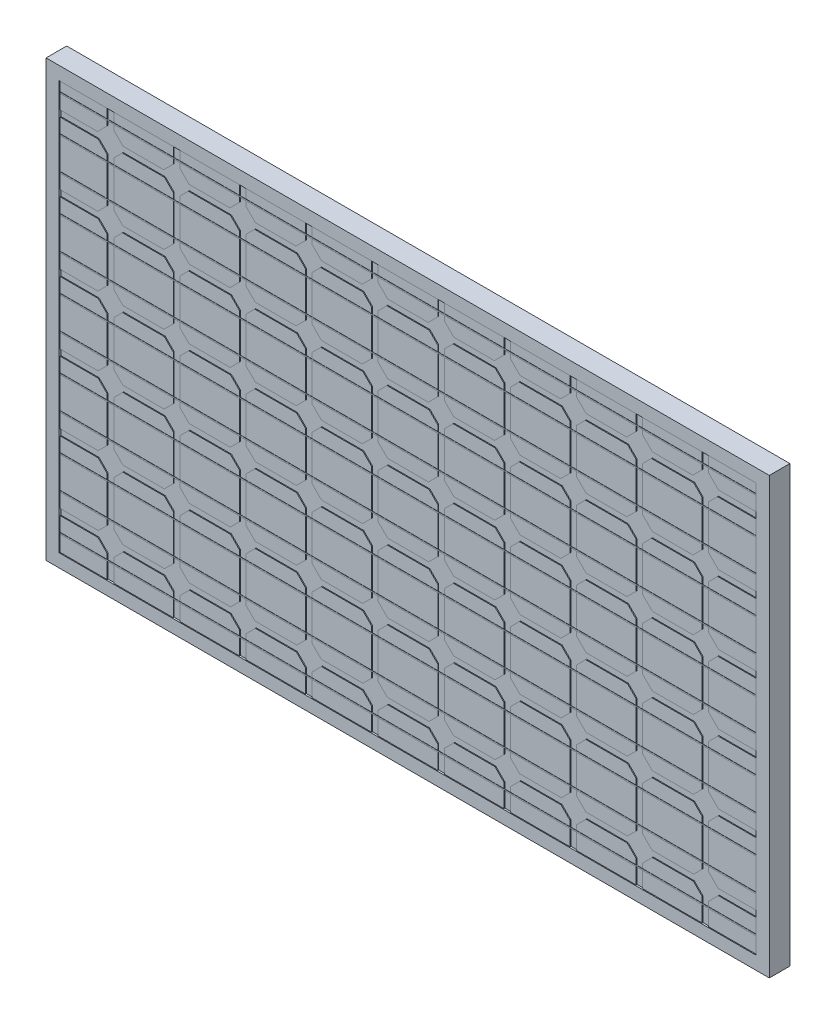
from build123d import *

# Parameters (mm, degrees)
ESQUISSE1_W             = 1650
ESQUISSE1_H             = 993
ESQUISSE1_W_2           = 1568
ESQUISSE1_H_2           = 911
BOSS_EXTRU_1_DEPTH      = 35
ESQUISSE2_W             = 1650
ESQUISSE2_H             = 993
BOSS_EXTRU_2_DEPTH      = 10
ESQUISSE3_W             = 14.939030316
ESQUISSE3_H             = 993
ESQUISSE3_W_2           = 14.939030315
ENL_V_MAT_EXTRU_1_DEPTH = 2
ESQUISSE4_W             = 1650
ESQUISSE4_H             = 14.187560781
ENL_V_MAT_EXTRU_2_DEPTH = 2
BOSS_EXTRU_3_DEPTH      = 2
BOSS_EXTRU_3_DEPTH_BACK = 2
ESQUISSE5_W             = 1650
ESQUISSE5_H             = 993
ESQUISSE5_W_2           = 1590
ESQUISSE5_H_2           = 933
ESQUISSE6_W             = 1568
ESQUISSE6_H             = 911
BOSS_EXTRU_4_DEPTH      = 35
ENL_V_MAT_EXTRU_3_DEPTH = 11
ESQUISSE8_W             = 1590
ESQUISSE8_H             = 3
BOSS_EXTRU_5_DEPTH      = 0.5
SCALE1_SCALE            = 0.25


with BuildPart() as part:
    # Esquisse1 → Boss.-Extru.1 (new body)
    with BuildSketch(Plane.XY):
        with Locations((825, -496.5)):
            Rectangle(ESQUISSE1_W, ESQUISSE1_H)
        with Locations((825, -496.5)):
            Rectangle(ESQUISSE1_W_2, ESQUISSE1_H_2, mode=Mode.SUBTRACT)
    extrude(amount=BOSS_EXTRU_1_DEPTH)

    # Esquisse2 → Boss.-Extru.2 (add)
    with BuildSketch(Plane.XY.offset(35)):
        with Locations((825, -496.5)):
            Rectangle(ESQUISSE2_W, ESQUISSE2_H)
    extrude(amount=BOSS_EXTRU_2_DEPTH)

    # Esquisse3 → Enlèv. mat.-Extru.1 (cut)
    with BuildSketch(Plane.XY.offset(45)):
        with Locations((144.959527633, -496.5)):
            Rectangle(ESQUISSE3_W, ESQUISSE3_H)
        with Locations((295.781951826, -496.5)):
            Rectangle(ESQUISSE3_W, ESQUISSE3_H)
        with Locations((446.604376019, -496.5)):
            Rectangle(ESQUISSE3_W_2, ESQUISSE3_H)
        with Locations((597.426800211, -496.5)):
            Rectangle(ESQUISSE3_W, ESQUISSE3_H)
        with Locations((748.249224403, -496.5)):
            Rectangle(ESQUISSE3_W_2, ESQUISSE3_H)
        with Locations((899.071648596, -496.5)):
            Rectangle(ESQUISSE3_W, ESQUISSE3_H)
        with Locations((1049.894072789, -496.5)):
            Rectangle(ESQUISSE3_W_2, ESQUISSE3_H)
        with Locations((1200.716496981, -496.5)):
            Rectangle(ESQUISSE3_W, ESQUISSE3_H)
        with Locations((1351.538921174, -496.5)):
            Rectangle(ESQUISSE3_W, ESQUISSE3_H)
        with Locations((1502.361345366, -496.5)):
            Rectangle(ESQUISSE3_W, ESQUISSE3_H)
    extrude(amount=-ENL_V_MAT_EXTRU_1_DEPTH, mode=Mode.SUBTRACT)

    # Esquisse4 → Enlèv. mat.-Extru.2 (cut)
    with BuildSketch(Plane.XY.offset(45)):
        with Locations((825, -95.862138587)):
            Rectangle(ESQUISSE4_W, ESQUISSE4_H)
        with Locations((825, -253.351569046)):
            Rectangle(ESQUISSE4_W, ESQUISSE4_H)
        with Locations((825, -410.840999504)):
            Rectangle(ESQUISSE4_W, ESQUISSE4_H)
        with Locations((825, -568.330429963)):
            Rectangle(ESQUISSE4_W, ESQUISSE4_H)
        with Locations((825, -725.819860421)):
            Rectangle(ESQUISSE4_W, ESQUISSE4_H)
        with Locations((825, -883.30929088)):
            Rectangle(ESQUISSE4_W, ESQUISSE4_H)
    extrude(amount=-ENL_V_MAT_EXTRU_2_DEPTH, mode=Mode.SUBTRACT)

    # Esquisse5 → Boss.-Extru.3 (add, two sides: drawn at the far end of the back side and taken through both)
    with BuildSketch(Plane.XY.offset(45).offset(-BOSS_EXTRU_3_DEPTH_BACK)):
        with Locations((825, -496.5)):
            Rectangle(ESQUISSE5_W, ESQUISSE5_H)
        with Locations((825, -496.5)):
            Rectangle(ESQUISSE5_W_2, ESQUISSE5_H_2, mode=Mode.SUBTRACT)
    extrude(amount=BOSS_EXTRU_3_DEPTH + BOSS_EXTRU_3_DEPTH_BACK)

    # Esquisse6 → Boss.-Extru.4 (add)
    with BuildSketch(Plane(origin=(0, 0, 35), x_dir=(-1, 0, 0), z_dir=(0, 0, -1))):
        with Locations((-825, -496.5)):
            Rectangle(ESQUISSE6_W, ESQUISSE6_H)
    extrude(amount=BOSS_EXTRU_4_DEPTH)

    # Esquisse7 → Enlèv. mat.-Extru.3 (cut)
    with BuildSketch(Plane.XY.offset(43)):
        Polygon((144.959527633, -761.17519948), (180.314866693, -725.819860421), (144.959527633, -690.464521361), (109.604188574, -725.819860421), align=None)
        Polygon((295.886179495, -761.143556599), (331.241518554, -725.78821754), (295.886179495, -690.43287848), (260.530840436, -725.78821754), align=None)
        Polygon((446.812831357, -761.111913718), (482.168170416, -725.756574659), (446.812831357, -690.401235599), (411.457492297, -725.756574659), align=None)
        Polygon((597.739483219, -761.080270837), (633.094822278, -725.724931777), (597.739483219, -690.369592718), (562.384144159, -725.724931777), align=None)
        Polygon((748.66613508, -761.048627956), (784.02147414, -725.693288896), (748.66613508, -690.337949837), (713.310796021, -725.693288896), align=None)
        Polygon((899.592786942, -761.016985075), (934.948126001, -725.661646015), (899.592786942, -690.306306956), (864.237447883, -725.661646015), align=None)
        Polygon((1050.519438804, -760.985342193), (1085.874777863, -725.630003134), (1050.519438804, -690.274664075), (1015.164099745, -725.630003134), align=None)
        Polygon((1201.446090666, -760.953699312), (1236.801429725, -725.598360253), (1201.446090666, -690.243021194), (1166.090751606, -725.598360253), align=None)
        Polygon((1352.372742527, -760.922056431), (1387.728081587, -725.566717372), (1352.372742527, -690.211378313), (1317.017403468, -725.566717372), align=None)
        Polygon((1503.299394389, -760.89041355), (1538.654733448, -725.535074491), (1503.299394389, -690.179735431), (1467.94405533, -725.535074491), align=None)
        Polygon((144.825598167, -603.482448799), (180.180937227, -568.127109739), (144.825598167, -532.77177068), (109.470259108, -568.127109739), align=None)
        Polygon((295.752250029, -603.450805917), (331.107589089, -568.095466858), (295.752250029, -532.740127799), (260.39691097, -568.095466858), align=None)
        Polygon((446.678901891, -603.419163036), (482.03424095, -568.063823977), (446.678901891, -532.708484918), (411.323562832, -568.063823977), align=None)
        Polygon((597.605553753, -603.387520155), (632.960892812, -568.032181096), (597.605553753, -532.676842037), (562.250214693, -568.032181096), align=None)
        Polygon((748.532205614, -603.355877274), (783.887544674, -568.000538215), (748.532205614, -532.645199155), (713.176866555, -568.000538215), align=None)
        Polygon((899.458857476, -603.324234393), (934.814196536, -567.968895334), (899.458857476, -532.613556274), (864.103518417, -567.968895334), align=None)
        Polygon((1050.385509338, -603.292591512), (1085.740848397, -567.937252453), (1050.385509338, -532.581913393), (1015.030170279, -567.937252453), align=None)
        Polygon((1201.3121612, -603.260948631), (1236.667500259, -567.905609571), (1201.3121612, -532.550270512), (1165.95682214, -567.905609571), align=None)
        Polygon((1352.238813062, -603.22930575), (1387.594152121, -567.87396669), (1352.238813062, -532.518627631), (1316.883474002, -567.87396669), align=None)
        Polygon((1503.165464923, -603.197662869), (1538.520803983, -567.842323809), (1503.165464923, -532.48698475), (1467.810125864, -567.842323809), align=None)
        Polygon((144.691668702, -445.789698117), (180.047007761, -410.434359058), (144.691668702, -375.079019998), (109.336329642, -410.434359058), align=None)
        Polygon((295.618320563, -445.758055236), (330.973659623, -410.402716177), (295.618320563, -375.047377117), (260.262981504, -410.402716177), align=None)
        Polygon((446.544972425, -445.726412355), (481.900311484, -410.371073295), (446.544972425, -375.015734236), (411.189633366, -410.371073295), align=None)
        Polygon((597.471624287, -445.694769474), (632.826963346, -410.339430414), (597.471624287, -374.984091355), (562.116285228, -410.339430414), align=None)
        Polygon((748.398276149, -445.663126593), (783.753615208, -410.307787533), (748.398276149, -374.952448474), (713.042937089, -410.307787533), align=None)
        Polygon((899.32492801, -445.631483712), (934.68026707, -410.276144652), (899.32492801, -374.920805593), (863.969588951, -410.276144652), align=None)
        Polygon((1050.251579872, -445.59984083), (1085.606918932, -410.244501771), (1050.251579872, -374.889162712), (1014.896240813, -410.244501771), align=None)
        Polygon((1201.178231734, -445.568197949), (1236.533570793, -410.21285889), (1201.178231734, -374.857519831), (1165.822892675, -410.21285889), align=None)
        Polygon((1352.104883596, -445.536555068), (1387.460222655, -410.181216009), (1352.104883596, -374.82587695), (1316.749544536, -410.181216009), align=None)
        Polygon((1503.031535457, -445.504912187), (1538.386874517, -410.149573128), (1503.031535457, -374.794234068), (1467.676196398, -410.149573128), align=None)
        Polygon((144.557739236, -288.096947436), (179.913078295, -252.741608376), (144.557739236, -217.386269317), (109.202400176, -252.741608376), align=None)
        Polygon((295.484391098, -288.065304554), (330.839730157, -252.709965495), (295.484391098, -217.354626436), (260.129052038, -252.709965495), align=None)
        Polygon((446.411042959, -288.033661673), (481.766382019, -252.678322614), (446.411042959, -217.322983555), (411.0557039, -252.678322614), align=None)
        Polygon((597.337694821, -288.002018792), (632.69303388, -252.646679733), (597.337694821, -217.291340674), (561.982355762, -252.646679733), align=None)
        Polygon((748.264346683, -287.970375911), (783.619685742, -252.615036852), (748.264346683, -217.259697792), (712.909007623, -252.615036852), align=None)
        Polygon((899.190998545, -287.93873303), (934.546337604, -252.583393971), (899.190998545, -217.228054911), (863.835659485, -252.583393971), align=None)
        Polygon((1050.117650406, -287.907090149), (1085.472989466, -252.55175109), (1050.117650406, -217.19641203), (1014.762311347, -252.55175109), align=None)
        Polygon((1201.044302268, -287.875447268), (1236.399641327, -252.520108208), (1201.044302268, -217.164769149), (1165.688963209, -252.520108208), align=None)
        Polygon((1351.97095413, -287.843804387), (1387.326293189, -252.488465327), (1351.97095413, -217.133126268), (1316.615615071, -252.488465327), align=None)
        Polygon((1502.897605992, -287.812161506), (1538.252945051, -252.456822446), (1502.897605992, -217.101483387), (1467.542266932, -252.456822446), align=None)
        Polygon((144.42380977, -130.404196754), (179.779148829, -95.048857695), (144.42380977, -59.693518635), (109.068470711, -95.048857695), align=None)
        Polygon((295.350461632, -130.372553873), (330.705800691, -95.017214814), (295.350461632, -59.661875754), (259.995122572, -95.017214814), align=None)
        Polygon((446.277113493, -130.340910992), (481.632452553, -94.985571932), (446.277113493, -59.630232873), (410.921774434, -94.985571932), align=None)
        Polygon((597.203765355, -130.309268111), (632.559104415, -94.953929051), (597.203765355, -59.598589992), (561.848426296, -94.953929051), align=None)
        Polygon((748.130417217, -130.27762523), (783.485756276, -94.92228617), (748.130417217, -59.566947111), (712.775078158, -94.92228617), align=None)
        Polygon((899.057069079, -130.245982348), (934.412408138, -94.890643289), (899.057069079, -59.53530423), (863.701730019, -94.890643289), align=None)
        Polygon((1049.983720941, -130.214339467), (1085.33906, -94.859000408), (1049.983720941, -59.503661349), (1014.628381881, -94.859000408), align=None)
        Polygon((1200.910372802, -130.182696586), (1236.265711862, -94.827357527), (1200.910372802, -59.472018468), (1165.555033743, -94.827357527), align=None)
        Polygon((1351.837024664, -130.151053705), (1387.192363723, -94.795714646), (1351.837024664, -59.440375587), (1316.481685605, -94.795714646), align=None)
        Polygon((1502.763676526, -130.119410824), (1538.119015585, -94.764071765), (1502.763676526, -59.408732705), (1467.408337466, -94.764071765), align=None)
        Polygon((144.959527633, -919.17519948), (180.314866692, -883.819860421), (144.959527633, -848.464521362), (109.604188574, -883.819860421), align=None)
        Polygon((295.886179495, -919.143556599), (331.241518554, -883.78821754), (295.886179495, -848.432878481), (260.530840436, -883.78821754), align=None)
        Polygon((446.812831357, -919.111913718), (482.168170416, -883.756574659), (446.812831357, -848.401235599), (411.457492297, -883.756574659), align=None)
        Polygon((597.739483218, -919.080270837), (633.094822278, -883.724931778), (597.739483218, -848.369592718), (562.384144159, -883.724931778), align=None)
        Polygon((748.66613508, -919.048627956), (784.02147414, -883.693288897), (748.66613508, -848.337949837), (713.310796021, -883.693288897), align=None)
        Polygon((899.592786942, -919.016985075), (934.948126001, -883.661646015), (899.592786942, -848.306306956), (864.237447883, -883.661646015), align=None)
        Polygon((1050.519438804, -918.985342194), (1085.874777863, -883.630003134), (1050.519438804, -848.274664075), (1015.164099744, -883.630003134), align=None)
        Polygon((1201.446090666, -918.953699313), (1236.801429725, -883.598360253), (1201.446090666, -848.243021194), (1166.090751606, -883.598360253), align=None)
        Polygon((1352.372742527, -918.922056431), (1387.728081587, -883.566717372), (1352.372742527, -848.211378313), (1317.017403468, -883.566717372), align=None)
        Polygon((1503.299394389, -918.89041355), (1538.654733448, -883.535074491), (1503.299394389, -848.179735432), (1467.94405533, -883.535074491), align=None)
    extrude(amount=ENL_V_MAT_EXTRU_3_DEPTH, mode=Mode.SUBTRACT)

    # Esquisse8 → Boss.-Extru.5 (add)
    with BuildSketch(Plane.XY.offset(45)):
        with Locations((825, -924.809290879)):
            Rectangle(ESQUISSE8_W, ESQUISSE8_H)
        with Locations((825, -841.809290879)):
            Rectangle(ESQUISSE8_W, ESQUISSE8_H)
        with Locations((825, -767.309290879)):
            Rectangle(ESQUISSE8_W, ESQUISSE8_H)
        with Locations((825, -684.309290879)):
            Rectangle(ESQUISSE8_W, ESQUISSE8_H)
        with Locations((825, -609.809290879)):
            Rectangle(ESQUISSE8_W, ESQUISSE8_H)
        with Locations((825, -526.809290879)):
            Rectangle(ESQUISSE8_W, ESQUISSE8_H)
        with Locations((825, -452.309290879)):
            Rectangle(ESQUISSE8_W, ESQUISSE8_H)
        with Locations((825, -369.309290879)):
            Rectangle(ESQUISSE8_W, ESQUISSE8_H)
        with Locations((825, -294.809290879)):
            Rectangle(ESQUISSE8_W, ESQUISSE8_H)
        with Locations((825, -211.809290879)):
            Rectangle(ESQUISSE8_W, ESQUISSE8_H)
        with Locations((825, -137.309290879)):
            Rectangle(ESQUISSE8_W, ESQUISSE8_H)
        with Locations((825, -54.309290879)):
            Rectangle(ESQUISSE8_W, ESQUISSE8_H)
    extrude(amount=BOSS_EXTRU_5_DEPTH)


with BuildPart() as part_1:
    # Scale1: scaled about (825.005608203, -496.531276539, 22.424225832)
    add(part.part.scale(SCALE1_SCALE).moved(Location((618.754206152, -372.398457404, 16.818169374))))


solid = part_1.part
